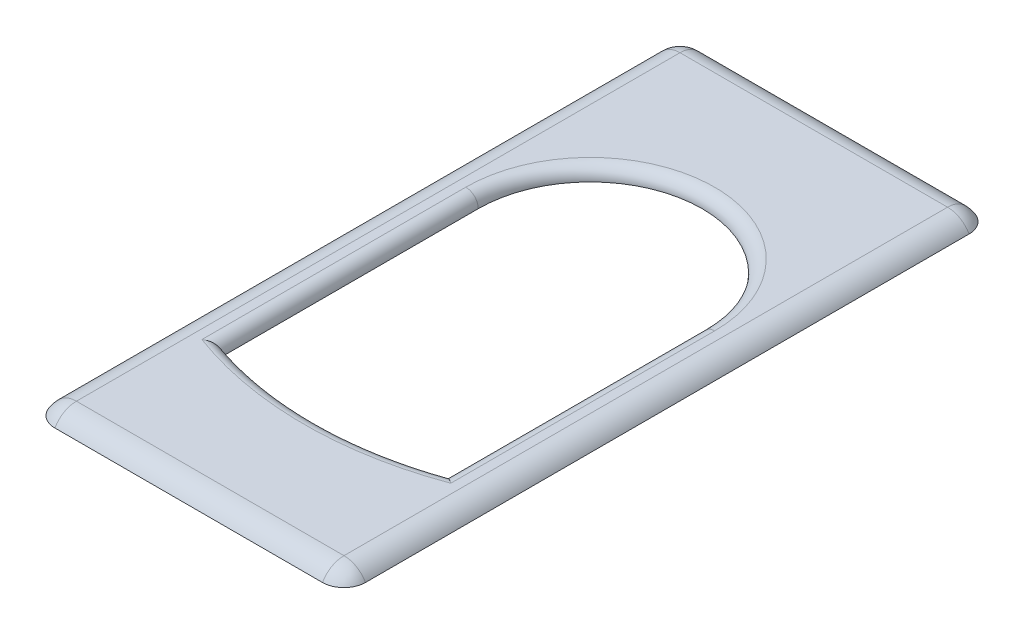
from build123d import *

# Parameters (mm, degrees)
EXTRUDE_1_DEPTH     = 2
FILLET_1_R          = 2
SKETCH_2_W          = 35.782546262
SKETCH_2_H          = 59.110257758
CUT_EXTRUDE_1_DEPTH = 1
FILLET_2_R          = 1


with BuildPart() as part:
    # 草图1 → 凸台-拉伸1 (new body)
    with BuildSketch(Plane(origin=(0, 0, 0), x_dir=(1, 0, 0), z_dir=(0, 1, 0))):
        with BuildLine():
            Line((-8.359432933, 36.099160402), (13.140567067, 36.099160402))
            ThreePointArc((13.140567067, 36.099160402), (14.554780629, 35.513373964), (15.140567067, 34.099160402))
            Line((15.140567067, 34.099160402), (15.140567067, -14.400839598))
            ThreePointArc((15.140567067, -14.400839598), (14.554780629, -15.81505316), (13.140567067, -16.400839598))
            Line((13.140567067, -16.400839598), (-8.359432933, -16.400839598))
            ThreePointArc((-8.359432933, -16.400839598), (-9.773646496, -15.81505316), (-10.359432933, -14.400839598))
            Line((-10.359432933, -14.400839598), (-10.359432933, 34.099160402))
            ThreePointArc((-10.359432933, 34.099160402), (-9.773646496, 35.513373964), (-8.359432933, 36.099160402))
        make_face()
        with BuildLine():
            Line((-6.609432933, 16.136804798), (-6.609432933, -4.363195202))
            ThreePointArc((-6.609432933, -4.363195202), (2.390567067, -5.863195202), (11.390567067, -4.363195202))
            Line((11.390567067, -4.363195202), (11.390567067, 16.136804798))
            ThreePointArc((11.390567067, 16.136804798), (8.754528097, 22.500765829), (2.390567067, 25.136804798))
            ThreePointArc((2.390567067, 25.136804798), (-3.973393964, 22.500765829), (-6.609432933, 16.136804798))
        make_face(mode=Mode.SUBTRACT)
    extrude(amount=EXTRUDE_1_DEPTH)

    # 圆角1
    fillet_1_edges = [part.edges().sort_by_distance(p)[0] for p in [
        (-9.773646496, 2, 15.81505316),
        (2.390567067, 2, 16.400839598),
        (14.554780629, 2, 15.81505316),
        (15.140567067, 2, -9.849160402),
        (-9.773646496, 2, -35.513373964),
        (14.554780629, 2, -35.513373964),
        (2.390567067, 2, -36.099160402),
        (-10.359432933, 2, -9.849160402),
    ]]
    fillet(fillet_1_edges, radius=FILLET_1_R - 0.0001)  # a hair under: the kernel refuses the full size

    # 草图2 → 切除-拉伸1 (cut)
    with BuildSketch(Plane(origin=(0, 0, 0), x_dir=(-1, 0, 0), z_dir=(0, -1, 0))):
        with Locations((0.496790494, 10.685635763)):
            Rectangle(SKETCH_2_W, SKETCH_2_H)
    extrude(amount=-CUT_EXTRUDE_1_DEPTH, mode=Mode.SUBTRACT)

    # 圆角2
    fillet_2_edges = [part.edges().sort_by_distance(p)[0] for p in [
        (11.390567067, 2, -5.886804798),
        (2.390567067, 2, -25.136804798),
        (-6.609432933, 2, -5.886804798),
        (2.390567067, 2, 5.863195202),
    ]]
    fillet(fillet_2_edges, radius=FILLET_2_R - 0.0001)  # a hair under: the kernel refuses the full size


solid = part.part
